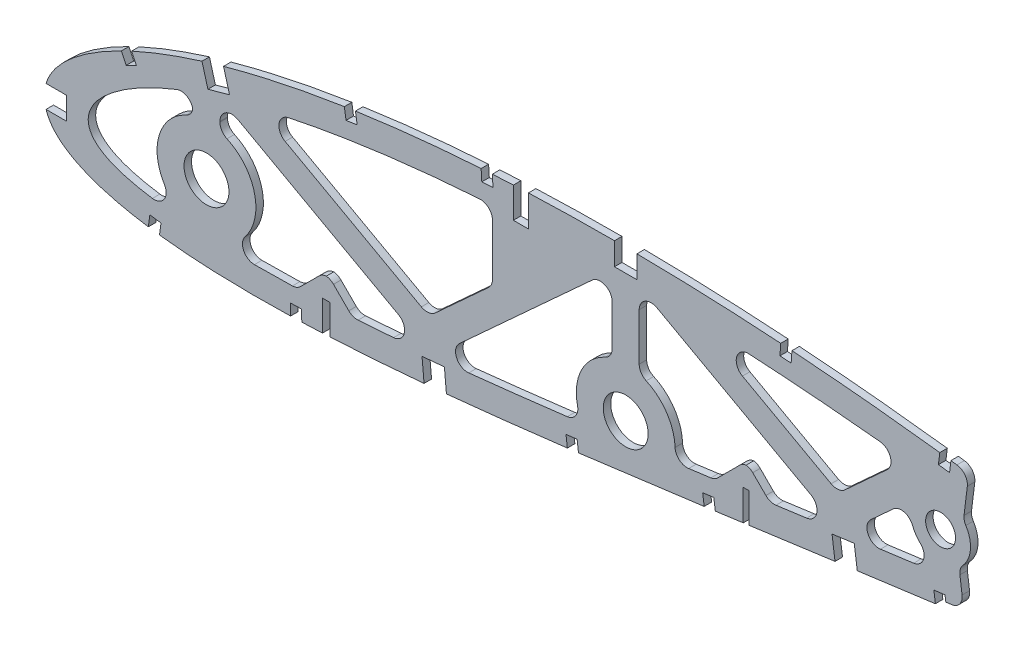
from build123d import *

# Parameters (mm, degrees)
BOSS_EXTRUDE1_DEPTH      = 3.175
CUT_EXTRUDE2_START       = -3.175
CUT_EXTRUDE2_OUTLINE_R   = 9.525
CUT_EXTRUDE2_OUTLINE_R_2 = 6.35
CUT_EXTRUDE2_DEPTH       = 3.175
CUT_EXTRUDE3_DEPTH       = 399.850153183
SKETCH3_W                = 3.175
SKETCH3_H                = 5.08
SKETCH3_W_2              = 2.54
BOSS_EXTRUDE2_DEPTH      = 3.175
CUT_EXTRUDE4_DEPTH       = 3.175
FILLET1_START            = -1
FILLET1_DEPTH            = 5
FILLET1_2_DEPTH          = 3.175


with BuildPart() as part:
    # Sketch1 → Boss-Extrude1 (new body)
    with BuildSketch(Plane.XY):
        with BuildLine():
            Line((554.319679776, 0.86419944), (558.957809165, -2.001035064))
            Line((558.957809165, -2.001035064), (553.628320224, -0.86419944))
            add(Edge.make_bspline(
                [(0, 0), (0.142347333, -0.671974339), (0.427696201, -2.019011291), (1.202951825, -3.958186399), (2.228190383, -5.822295383), (3.524929277, -7.606386734), (5.084546434, -9.309972854), (6.903597265, -10.934825666), (8.980297835, -12.480071531), (11.311930113, -13.945007192), (13.895107055, -15.331187734), (16.726925172, -16.637751335), (19.804802415, -17.864289685), (23.125385358, -19.009163213), (26.684614497, -20.074115536), (30.479105895, -21.056551439), (34.504544841, -21.957844058), (38.757059621, -22.775692741), (43.232016315, -23.51092839), (47.924766072, -24.163139529), (52.830492114, -24.732734078), (57.944381557, -25.218516849), (63.261376247, -25.621532707), (68.776176668, -25.942049027), (74.483429701, -26.181082136), (80.377668399, -26.337723359), (86.453120028, -26.414414727), (92.704294081, -26.412307583), (99.12507542, -26.330838336), (105.709979181, -26.174507632), (112.452686417, -25.942325241), (119.34710982, -25.637100851), (126.387030529, -25.261906112), (133.566134503, -24.818012975), (140.878103886, -24.307388732), (148.316589874, -23.734128332), (155.874835295, -23.099661672), (163.546248351, -22.407686904), (171.324037493, -21.661668186), (179.201482843, -20.863966544), (187.171631155, -20.018334408), (195.227383554, -19.127512044), (203.361887075, -18.196251983), (211.567710876, -17.226239107), (219.837916048, -16.22301178), (228.164722411, -15.188486752), (236.541167073, -14.126648704), (244.959716224, -13.042497308), (253.412488668, -11.935908902), (261.892375024, -10.814767477), (270.391197565, -9.678149682), (278.901558654, -8.531901132), (287.415580323, -7.379584718), (295.924969849, -6.221555103), (304.422247183, -5.062611436), (312.899529628, -3.905935256), (321.348513524, -2.751632242), (329.761554776, -1.605439772), (338.130181703, -0.467217682), (346.446677596, 0.66072628), (354.703072912, 1.775025333), (362.891578136, 2.874273125), (371.003746299, 3.95777416), (379.031415912, 5.025935363), (386.846329345, 6.046335331), (394.428066205, 7.073310729), (401.802175451, 7.915202937), (409.084467689, 8.633788237), (416.282507375, 9.222929029), (423.387651297, 9.691101248), (430.391758492, 10.041650224), (437.286481508, 10.279470026), (444.063111322, 10.411615906), (450.713183761, 10.441441391), (457.227621753, 10.378458054), (463.597952606, 10.227742854), (469.815285453, 9.996060674), (475.870946567, 9.691228076), (481.756334452, 9.321555013), (487.462613384, 8.892494437), (492.981831848, 8.414063018), (498.305474549, 7.893264408), (503.42536692, 7.336048865), (508.334038343, 6.754092224), (513.023631908, 6.151226115), (517.487093749, 5.537357776), (521.717238913, 4.918708145), (525.707368004, 4.303175514), (529.451211936, 3.69663199), (532.942723228, 3.107128036), (536.176432542, 2.540171416), (539.146728498, 2.001298937), (541.849490456, 1.497309641), (544.279380439, 1.030707122), (546.433148645, 0.609181062), (548.306790372, 0.234591467), (549.897558991, -0.087784135), (551.202676422, -0.356673457), (552.220160436, -0.56766247), (552.948001318, -0.721088328), (553.38541182, -0.812384542), (553.579758931, -0.853840809), (553.628320224, -0.86419944)],
                knots=[0, 0, 0, 0, 0.003638255, 0.007293231, 0.011028136, 0.014901081, 0.018963272, 0.023258475, 0.027820626, 0.032679082, 0.03785316, 0.043361875, 0.049214679, 0.055422346, 0.061988786, 0.068918036, 0.076211157, 0.083868392, 0.091887411, 0.100265912, 0.108999867, 0.118084529, 0.127514843, 0.13728527, 0.147387917, 0.157816481, 0.168563473, 0.179619128, 0.190977373, 0.202626974, 0.214560478, 0.226767249, 0.239236417, 0.251959004, 0.264923894, 0.278119703, 0.291536035, 0.30516028, 0.318980685, 0.332985499, 0.34716279, 0.361498603, 0.375980747, 0.390597192, 0.405332593, 0.420174823, 0.435109533, 0.450124276, 0.465203068, 0.480333154, 0.495500583, 0.510689775, 0.525887334, 0.541078314, 0.556247233, 0.571381784, 0.58646604, 0.601484516, 0.616424329, 0.631269422, 0.646006524, 0.660620684, 0.675098187, 0.689422858, 0.703581825, 0.716907563, 0.730009274, 0.742952128, 0.755725558, 0.768319952, 0.780724337, 0.792926529, 0.804916041, 0.816679084, 0.828203524, 0.8394749, 0.850481359, 0.861207697, 0.871639326, 0.881763414, 0.891563605, 0.901027364, 0.910138977, 0.918883976, 0.927249278, 0.935221104, 0.942784739, 0.949928188, 0.956638464, 0.962904203, 0.968712288, 0.974054485, 0.978918432, 0.983297218, 0.987180246, 0.990560674, 0.993433357, 0.995790626, 0.997629587, 0.998945816, 0.999736592, 1, 1, 1, 1], degree=3))
            add(Edge.make_bspline(
                [(554.319679776, 0.86419944), (554.277215357, 0.89043211), (554.107522459, 0.995260998), (553.725173452, 1.229788681), (553.088482836, 1.620406322), (552.19717161, 2.164400829), (551.051931791, 2.860327436), (549.65218736, 3.7033132), (547.998812126, 4.690619378), (546.092206237, 5.81757636), (543.932565, 7.078907467), (541.52071076, 8.469502775), (538.856853433, 9.981489509), (535.942024994, 11.608689713), (532.777225355, 13.343364367), (529.363053286, 15.177678879), (525.700731311, 17.102302694), (521.79166531, 19.108957931), (517.636567952, 21.18656326), (513.237398289, 23.326472309), (508.595621965, 25.518015349), (503.712823317, 27.749500198), (498.591807417, 30.011830061), (493.233990123, 32.290940283), (487.642424763, 34.57695634), (481.8194918, 36.856868062), (475.768638934, 39.12029206), (469.492200651, 41.35256543), (462.994868721, 43.543932934), (456.279795024, 45.680158729), (449.351781723, 47.749641178), (442.214854104, 49.738962731), (434.874961581, 51.637921), (427.336759134, 53.432686996), (419.606635925, 55.111247293), (411.690736529, 56.663495899), (403.59569977, 58.073935714), (395.343957759, 59.341467114), (387.068279135, 60.395838633), (378.809627081, 61.42993544), (370.563274167, 62.401374837), (362.216133558, 63.331662392), (353.776235693, 64.21556045), (345.251952273, 65.05030505), (336.651912889, 65.832293537), (327.985054567, 66.559232675), (319.259763743, 67.227003304), (310.485240764, 67.834576684), (301.670160415, 68.37661144), (292.823911811, 68.852700647), (283.955475072, 69.25952388), (275.074079257, 69.594278035), (266.18915515, 69.854942273), (257.309925599, 70.039019354), (248.446004557, 70.145351939), (239.606611877, 70.171034575), (230.801357025, 70.115607817), (222.039460543, 69.97716855), (213.3305417, 69.753821594), (204.683833617, 69.445150093), (196.108686361, 69.051287938), (187.614488849, 68.568936811), (179.210455771, 68.001170586), (170.905945703, 67.345604232), (162.710082946, 66.602063396), (154.631456842, 65.773647434), (146.679061666, 64.85810318), (138.86141998, 63.858035618), (131.187082706, 62.775405546), (123.664660665, 61.60962319), (116.302212041, 60.364055914), (109.107683022, 59.039978082), (102.088685401, 57.641271481), (95.252861003, 56.16830103), (88.607445909, 54.6254852), (82.159346438, 53.015511993), (75.915494147, 51.341328746), (69.8822185, 49.606952764), (64.065620452, 47.816318831), (58.472480769, 45.971394518), (53.107026632, 44.079174913), (47.975848961, 42.141003285), (43.082878389, 40.162850581), (38.433849103, 38.1474178), (34.032234114, 36.100849009), (29.88301504, 34.025474172), (25.989149052, 31.927107779), (22.354545271, 29.808967438), (18.982702419, 27.674987384), (15.875037644, 25.530580581), (13.035835571, 23.377093004), (10.466071509, 21.219966433), (8.16737168, 19.062485607), (6.143021854, 16.906136722), (4.392949166, 14.754717117), (2.919447156, 12.609930647), (1.722771461, 10.473806788), (0.805628768, 8.347897258), (0.167109617, 6.233397613), (-0.182411483, 4.133428796), (-0.269409401, 2.046307302), (-0.089668952, 0.681083253), (0, 0)],
                knots=[0, 0, 0, 0, 0.00025409, 0.001015373, 0.002283359, 0.004056577, 0.006330982, 0.009105274, 0.012374489, 0.016134023, 0.02037966, 0.025105976, 0.030306237, 0.035972206, 0.042099522, 0.048678064, 0.055701664, 0.063160184, 0.071045824, 0.079349827, 0.08806291, 0.097175756, 0.106678112, 0.116561573, 0.126814276, 0.137428301, 0.148393618, 0.15969976, 0.171338126, 0.183297699, 0.195569604, 0.208143555, 0.221011593, 0.234161831, 0.24758745, 0.261276822, 0.27522271, 0.289414144, 0.3037712, 0.317689227, 0.331784111, 0.346039677, 0.360443869, 0.37498272, 0.389640454, 0.404403317, 0.419256601, 0.434186749, 0.449177265, 0.464214782, 0.479284009, 0.49436974, 0.509457833, 0.524532346, 0.53957932, 0.554582984, 0.569529546, 0.584403417, 0.599190992, 0.613876838, 0.628447475, 0.642888675, 0.657186054, 0.671325546, 0.685294014, 0.699078147, 0.712665095, 0.726042645, 0.739197713, 0.752117586, 0.764792042, 0.777208152, 0.789355685, 0.80122396, 0.812803686, 0.824082909, 0.835054602, 0.845709571, 0.856037853, 0.866033834, 0.875688843, 0.884997719, 0.893953426, 0.902552897, 0.910789386, 0.918660734, 0.926166253, 0.933302626, 0.94007122, 0.94647478, 0.952517526, 0.958204819, 0.963546652, 0.9685566, 0.973249913, 0.977651041, 0.981787043, 0.985694226, 0.989415109, 0.993001157, 0.996508416, 1, 1, 1, 1], degree=3))
        make_face()
    extrude(amount=BOSS_EXTRUDE1_DEPTH)

    # Cut-Extrude2: read off the stored shape, not the designer's step
    # Cut-Extrude2 outline → Cut-Extrude2 (cut)
    with BuildSketch(Plane.XY.offset(3.175).offset(CUT_EXTRUDE2_START)):
        with BuildLine():
            Line((62.865, 26.51062499), (62.865, 35.371194991))
            add(Edge.make_bspline(
                [(62.865, 35.371194991), (22.76246738, 21.810295737), (-4.605530705, -4.886229322), (45.651130118, -12.296225469)],
                knots=[0, 0, 0, 0, 1, 1, 1, 1], degree=3))
            ThreePointArc((45.651130118, -12.296225469), (50.632113396, -10.068583428), (50.721470273, -4.612889263))
            ThreePointArc((50.721470273, -4.612889263), (49.058316906, 13.966817852), (62.865, 26.51062499))
        make_face()
        with BuildLine():
            ThreePointArc((252.095, 26.51062499), (264.489764964, 16.892695952), (266.733492485, 1.3652865))
            add(Edge.make_bspline(
                [(266.733492485, 1.3652865), (268.366969982, 1.584002003), (281.651386627, 3.366883879), (299.182126849, 5.757369901), (316.351499986, 8.102364536), (321.861023133, 8.853577955), (323.128166996, 9.026279511)],
                knots=[0.491689101, 0.491689101, 0.491689101, 0.491689101, 0.50044456, 0.56288899, 0.58559344, 0.59237477, 0.59237477, 0.59237477, 0.59237477], degree=3))
            ThreePointArc((323.128166996, 9.026279511), (327.436096941, 13.128695222), (324.895868611, 18.507850835))
            Line((324.895868611, 18.507850835), (252.095, 58.667223644))
            Line((252.095, 58.667223644), (252.095, 26.51062499))
        make_face()
        with BuildLine():
            ThreePointArc((350.32545902, 22.054682282), (349.150260326, 16.154547184), (354.429807705, 13.270268136))
            add(Edge.make_bspline(
                [(354.429807705, 13.270268136), (355.159641297, 13.368426329), (356.72292081, 13.578525236), (361.050011801, 14.159181472), (365.012389599, 14.68913133), (368.140539618, 15.106459985), (368.505422489, 15.155126578)],
                knots=[0.648196103, 0.648196103, 0.648196103, 0.648196103, 0.65209888, 0.656555635, 0.671334545, 0.673285933, 0.673285933, 0.673285933, 0.673285933], degree=3))
            ThreePointArc((368.505422489, 15.155126578), (372.675755085, 18.653635102), (371.286516438, 23.916832974))
            ThreePointArc((371.286516438, 23.916832974), (367.458763624, 30.772693993), (368.393761968, 38.568866132))
            Line((368.393761968, 38.568866132), (350.32545902, 22.054682282))
        make_face()
        with BuildLine():
            Line((336.675400902, 25.063606537), (365.552356002, 51.456751865))
            add(Edge.make_bspline(
                [(365.552356002, 51.456751865), (364.797081097, 51.541135498), (363.28612212, 51.70855557), (356.227836524, 52.477138846), (343.881379823, 53.730686124), (326.217500472, 55.269607058), (305.213684073, 56.778569262), (288.740470923, 57.638941116), (278.330264723, 58.031170169), (276.814196646, 58.08503148)],
                knots=[0.338225804, 0.338225804, 0.338225804, 0.338225804, 0.34212872, 0.346031635, 0.374679876, 0.405903199, 0.437126522, 0.482920481, 0.490726312, 0.490726312, 0.490726312, 0.490726312], degree=3))
            Line((276.814196646, 58.08503148), (336.675400902, 25.063606537))
        make_face()
        with BuildLine():
            Line((189.86500008, 27.78308848), (189.86500008, 57.240060847))
            add(Edge.make_bspline(
                [(189.86500008, 57.240060847), (187.063917312, 57.071520312), (178.038965708, 56.478843678), (157.007825959, 54.710152185), (132.906042701, 51.69376088), (110.107646573, 47.675012244), (97.887220649, 45.070252562), (91.565344534, 43.564313492), (90.226243863, 43.237828083)],
                knots=[0.640183475, 0.640183475, 0.640183475, 0.640183475, 0.654678253, 0.686913106, 0.749359752, 0.780583075, 0.807390144, 0.814611821, 0.814611821, 0.814611821, 0.814611821], degree=3))
            Line((90.226243863, 43.237828083), (162.90759448, 3.144385361))
            Line((162.90759448, 3.144385361), (189.86500008, 27.78308848))
        make_face()
        with BuildLine():
            ThreePointArc((84.95217689, -6.729137926), (84.342190601, -12.099649242), (88.915920299, -14.979835297))
            add(Edge.make_bspline(
                [(88.915920299, -14.979835297), (90.35299962, -14.981325891), (93.229497815, -14.971352785), (101.799896076, -14.869084655), (114.731393163, -14.466783507), (130.155154447, -13.613720807), (141.25346805, -12.820350397), (146.550437705, -12.401296511), (147.935568697, -12.28908831)],
                knots=[0.173000219, 0.173000219, 0.173000219, 0.173000219, 0.180805773, 0.188611327, 0.219444625, 0.25066684, 0.271707071, 0.279155772, 0.279155772, 0.279155772, 0.279155772], degree=3))
            ThreePointArc((147.935568697, -12.28908831), (152.492048606, -8.292757779), (149.979108862, -2.777569594))
            Line((149.979108862, -2.777569594), (74.295, 38.972294131))
            Line((74.295, 38.972294131), (74.295, 26.51062499))
            ThreePointArc((74.295, 26.51062499), (88.534480836, 12.747712058), (84.95217689, -6.729137926))
        make_face()
        with BuildLine():
            ThreePointArc((175.863374995, -0.499099206), (174.657175701, -6.331597494), (179.819975236, -9.301185677))
            add(Edge.make_bspline(
                [(179.819975236, -9.301185677), (181.091416031, -9.16796419), (188.409144309, -8.392799339), (204.460290686, -6.591474723), (219.247423117, -4.787683401), (227.985591734, -3.687816971)],
                knots=[0.336261412, 0.336261412, 0.336261412, 0.336261412, 0.343089121, 0.3755557, 0.422429392, 0.422429392, 0.422429392, 0.422429392], degree=3))
            ThreePointArc((227.985591734, -3.687816971), (227.058965712, 14.46231527), (240.665, 26.51062499))
            Line((240.665, 26.51062499), (240.665, 58.728707198))
            Line((240.665, 58.728707198), (175.863374995, -0.499099206))
        make_face()
        with Locations((246.38, 6.35)):
            Circle(CUT_EXTRUDE2_OUTLINE_R)
        with BuildLine():
            ThreePointArc((389.625833749, 41.421162193), (392.552928096, 31.946069054), (387.776134328, 23.255412427))
            Line((387.776134328, 23.255412427), (389.985810257, 6.471158122))
            add(Edge.make_bspline(
                [(389.985810257, 6.471158122), (391.481008099, 6.669843999), (395.425301496, 7.187163751), (401.802175451, 7.915202937), (409.084467689, 8.633788237), (416.282507375, 9.222929029), (423.387651297, 9.691101248), (430.391758492, 10.041650224), (437.286481508, 10.279470026), (444.063111322, 10.411615906), (450.713183761, 10.441441391), (457.227621753, 10.378458054), (463.597952606, 10.227742854), (469.815285453, 9.996060674), (475.870946567, 9.691228076), (481.756334452, 9.321555013), (487.462613384, 8.892494437), (492.981831848, 8.414063018), (498.305474549, 7.893264408), (503.42536692, 7.336048865), (508.334038343, 6.754092224), (513.023631908, 6.151226115), (517.487093749, 5.537357776), (521.717238913, 4.918708145), (525.707368004, 4.303175514), (529.451211936, 3.69663199), (532.942723228, 3.107128036), (536.176432542, 2.540171416), (539.146728498, 2.001298937), (541.849490456, 1.497309641), (544.279380439, 1.030707122), (546.433148645, 0.609181062), (548.306790372, 0.234591467), (549.897558991, -0.087784135), (551.202676422, -0.356673457), (552.220160436, -0.56766247), (552.948001318, -0.721088328), (553.38541182, -0.812384542), (553.579758931, -0.853840809), (553.628320224, -0.86419944)],
                knots=[0.708906055, 0.708906055, 0.708906055, 0.708906055, 0.716907563, 0.730009274, 0.742952128, 0.755725558, 0.768319952, 0.780724337, 0.792926529, 0.804916041, 0.816679084, 0.828203524, 0.8394749, 0.850481359, 0.861207697, 0.871639326, 0.881763414, 0.891563605, 0.901027364, 0.910138977, 0.918883976, 0.927249278, 0.935221104, 0.942784739, 0.949928188, 0.956638464, 0.962904203, 0.968712288, 0.974054485, 0.978918432, 0.983297218, 0.987180246, 0.990560674, 0.993433357, 0.995790626, 0.997629587, 0.998945816, 0.999736592, 1, 1, 1, 1], degree=3))
            Line((553.628320224, -0.86419944), (558.957809165, -2.001035064))
            Line((558.957809165, -2.001035064), (554.319679776, 0.86419944))
            add(Edge.make_bspline(
                [(554.319679776, 0.86419944), (554.277215357, 0.89043211), (554.107522459, 0.995260998), (553.725173452, 1.229788681), (553.088482836, 1.620406322), (552.19717161, 2.164400829), (551.051931791, 2.860327436), (549.65218736, 3.7033132), (547.998812126, 4.690619378), (546.092206237, 5.81757636), (543.932565, 7.078907467), (541.52071076, 8.469502775), (538.856853433, 9.981489509), (535.942024994, 11.608689713), (532.777225355, 13.343364367), (529.363053286, 15.177678879), (525.700731311, 17.102302694), (521.79166531, 19.108957931), (517.636567952, 21.18656326), (513.237398289, 23.326472309), (508.595621965, 25.518015349), (503.712823317, 27.749500198), (498.591807417, 30.011830061), (493.233990123, 32.290940283), (487.642424763, 34.57695634), (481.8194918, 36.856868062), (475.768638934, 39.12029206), (469.492200651, 41.35256543), (462.994868721, 43.543932934), (456.279795024, 45.680158729), (449.351781723, 47.749641178), (442.214854104, 49.738962731), (434.874961581, 51.637921), (427.336759134, 53.432686996), (419.606635925, 55.111247293), (411.690736529, 56.663495899), (403.59569977, 58.073935714), (396.967104189, 59.092139268), (393.036714305, 59.622971652), (391.868484593, 59.776786455)],
                knots=[0, 0, 0, 0, 0.00025409, 0.001015373, 0.002283359, 0.004056577, 0.006330982, 0.009105274, 0.012374489, 0.016134023, 0.02037966, 0.025105976, 0.030306237, 0.035972206, 0.042099522, 0.048678064, 0.055701664, 0.063160184, 0.071045824, 0.079349827, 0.08806291, 0.097175756, 0.106678112, 0.116561573, 0.126814276, 0.137428301, 0.148393618, 0.15969976, 0.171338126, 0.183297699, 0.195569604, 0.208143555, 0.221011593, 0.234161831, 0.24758745, 0.261276822, 0.27522271, 0.289414144, 0.295412407, 0.295412407, 0.295412407, 0.295412407], degree=3))
            Line((391.868484593, 59.776786455), (389.625833749, 41.421162193))
        make_face()
        with Locations((68.58, 6.35)):
            Circle(CUT_EXTRUDE2_OUTLINE_R)
        with Locations((379.918257434, 33.232574886)):
            Circle(CUT_EXTRUDE2_OUTLINE_R_2)
    extrude(amount=CUT_EXTRUDE2_DEPTH, mode=Mode.SUBTRACT)

    # Sketch2<6> → Cut-Extrude3 (cut, through all)
    with BuildSketch(Plane.XY.offset(3.175)):
        with BuildLine():
            Line((46.282123079, -23.928931383), (46.923353507, -19.196153821))
            Line((46.923353507, -19.196153821), (44.563663151, -18.876446158))
            Line((44.563663151, -18.876446158), (43.9243348, -23.595184923))
            add(Edge.make_bspline(
                [(43.9243348, -23.595184923), (44.709577271, -23.711215689), (45.495540051, -23.822359509), (46.282123079, -23.928931383)],
                knots=[0.093239963, 0.093239963, 0.093239963, 0.093239963, 0.097450722, 0.097450722, 0.097450722, 0.097450722], degree=3))
        make_face()
        with BuildLine():
            Line((49.283043862, -19.515861485), (46.923353507, -19.196153821))
            Line((46.923353507, -19.196153821), (46.282123079, -23.928931383))
            add(Edge.make_bspline(
                [(46.282123079, -23.928931383), (46.808009355, -24.000182203), (47.595005258, -24.10369717), (48.382554507, -24.202850809), (48.643628535, -24.235242195)],
                knots=[0.097450722, 0.097450722, 0.097450722, 0.097450722, 0.100265912, 0.101661472, 0.101661472, 0.101661472, 0.101661472], degree=3))
            Line((48.643628535, -24.235242195), (49.283043862, -19.515861485))
        make_face()
        with BuildLine():
            Line((38.850811769, 33.0821962), (36.798260056, 37.379688226))
            add(Edge.make_bspline(
                [(36.798260056, 37.379688226), (35.854068206, 36.944595052), (34.417979427, 36.267729731), (32.991764689, 35.570359965), (32.50076803, 35.327136512)],
                knots=[0.905497301, 0.905497301, 0.905497301, 0.905497301, 0.910789386, 0.913578602, 0.913578602, 0.913578602, 0.913578602], degree=3))
            Line((32.50076803, 35.327136512), (34.553319743, 31.029644486))
            Line((34.553319743, 31.029644486), (38.850811769, 33.0821962))
        make_face()
        with BuildLine():
            Line((69.187204427, 39.564220025), (73.775611576, 40.840122093))
            Line((73.775611576, 40.840122093), (78.364018724, 42.116024161))
            Line((78.364018724, 42.116024161), (75.812214588, 51.292838459))
            add(Edge.make_bspline(
                [(75.812214588, 51.292838459), (73.811767609, 50.736572557), (70.759892392, 49.859003491), (67.721063759, 48.937534558), (66.6709837, 48.613069038)],
                knots=[0.835139898, 0.835139898, 0.835139898, 0.835139898, 0.845709571, 0.851304368, 0.851304368, 0.851304368, 0.851304368], degree=3))
            Line((66.6709837, 48.613069038), (69.187204427, 39.564220025))
        make_face()
        with BuildLine():
            Line((104.106698263, -21.443073409), (104.252255503, -26.203348542))
            add(Edge.make_bspline(
                [(104.252255503, -26.203348542), (104.720230733, -26.190827386), (105.513674618, -26.168693156), (106.307074257, -26.145045284), (106.632531393, -26.135093624)],
                knots=[0.20014354, 0.20014354, 0.20014354, 0.20014354, 0.202626974, 0.204354288, 0.204354288, 0.204354288, 0.204354288], degree=3))
            Line((106.632531393, -26.135093624), (106.48683583, -21.370294789))
            Line((106.48683583, -21.370294789), (104.106698263, -21.443073409))
        make_face()
        with BuildLine():
            Line((108.866973396, -21.297516169), (106.48683583, -21.370294789))
            Line((106.48683583, -21.370294789), (106.632531393, -26.135093624))
            add(Edge.make_bspline(
                [(106.632531393, -26.135093624), (107.425912325, -26.110834031), (108.21924761, -26.085083218), (109.012533833, -26.057895847)],
                knots=[0.204354288, 0.204354288, 0.204354288, 0.204354288, 0.208565035, 0.208565035, 0.208565035, 0.208565035], degree=3))
            Line((109.012533833, -26.057895847), (108.866973396, -21.297516169))
        make_face()
        with BuildLine():
            Line((127.771211762, 57.422190036), (130.125676221, 57.778348255))
            Line((130.125676221, 57.778348255), (129.583477257, 62.518101997))
            add(Edge.make_bspline(
                [(129.583477257, 62.518101997), (128.741656434, 62.391032848), (127.900124949, 62.262045789), (127.058895324, 62.131118953)],
                knots=[0.741874989, 0.741874989, 0.741874989, 0.741874989, 0.746208858, 0.746208858, 0.746208858, 0.746208858], degree=3))
            Line((127.058895324, 62.131118953), (127.771211762, 57.422190036))
        make_face()
        with BuildLine():
            Line((129.583477257, 62.518101997), (130.125676221, 57.778348255))
            Line((130.125676221, 57.778348255), (132.480140679, 58.134506475))
            Line((132.480140679, 58.134506475), (131.76782424, 62.843435391))
            add(Edge.make_bspline(
                [(131.76782424, 62.843435391), (131.559841446, 62.812874242), (130.83157431, 62.705448955), (130.103517718, 62.596599816), (129.583477257, 62.518101997)],
                knots=[0.738127599, 0.738127599, 0.738127599, 0.738127599, 0.739197713, 0.741874989, 0.741874989, 0.741874989, 0.741874989], degree=3))
        make_face()
        with BuildLine():
            Line((159.993993488, -13.128883679), (160.860592372, -22.64756926))
            add(Edge.make_bspline(
                [(160.860592372, -22.64756926), (161.743392203, -22.567197517), (164.905050661, -22.276138875), (168.065684683, -21.974087842), (170.34336475, -21.751050719)],
                knots=[0.300457763, 0.300457763, 0.300457763, 0.300457763, 0.30516028, 0.317300898, 0.317300898, 0.317300898, 0.317300898], degree=3))
            Line((170.34336475, -21.751050719), (169.479762639, -12.265281568))
            Line((169.479762639, -12.265281568), (159.993993488, -13.128883679))
        make_face()
        with BuildLine():
            Line((185.349576322, 63.637065961), (187.726203141, 63.785378225))
            Line((187.726203141, 63.785378225), (187.18380527, 68.526870756))
            add(Edge.make_bspline(
                [(187.18380527, 68.526870756), (186.473459079, 68.482323115), (185.763173314, 68.436811372), (185.052951793, 68.390319598)],
                knots=[0.64357456, 0.64357456, 0.64357456, 0.64357456, 0.647197719, 0.647197719, 0.647197719, 0.647197719], degree=3))
            Line((185.052951793, 68.390319598), (185.349576322, 63.637065961))
        make_face()
        with BuildLine():
            Line((187.18380527, 68.526870756), (187.726203141, 63.785378225))
            Line((187.726203141, 63.785378225), (190.102829959, 63.933690489))
            Line((190.102829959, 63.933690489), (189.80620543, 68.686944127))
            add(Edge.make_bspline(
                [(189.80620543, 68.686944127), (189.066484154, 68.643026747), (188.192335869, 68.589892859), (187.318277975, 68.535303886), (187.18380527, 68.526870756)],
                knots=[0.639116453, 0.639116453, 0.639116453, 0.639116453, 0.642888675, 0.64357456, 0.64357456, 0.64357456, 0.64357456], degree=3))
        make_face()
        with BuildLine():
            add(Edge.make_bspline(
                [(251.146356975, 70.108083525), (250.243381525, 70.117300822), (247.068451926, 70.145350405), (243.893405422, 70.157877141), (241.621376732, 70.158797251)],
                knots=[0.534982426, 0.534982426, 0.534982426, 0.534982426, 0.53957932, 0.551145224, 0.551145224, 0.551145224, 0.551145224], degree=3))
            Line((241.621376732, 70.158797251), (241.617500391, 60.586941672))
            Line((241.617500391, 60.586941672), (251.142499609, 60.583084306))
            Line((251.142499609, 60.583084306), (251.146356975, 70.108083525))
        make_face()
        with BuildLine():
            add(Edge.make_bspline(
                [(221.639385319, -15.99720981), (223.214934587, -15.802784678), (224.790328976, -15.607104246), (226.365579887, -15.410276118)],
                knots=[0.40857865, 0.40857865, 0.40857865, 0.40857865, 0.41700016, 0.41700016, 0.41700016, 0.41700016], degree=3))
            Line((226.365579887, -15.410276118), (225.778619352, -10.684084883))
            Line((225.778619352, -10.684084883), (221.052428118, -11.271045418))
            Line((221.052428118, -11.271045418), (221.639385319, -15.99720981))
        make_face()
        with BuildLine():
            Line((279.020424763, -3.709183107), (279.658796345, -8.428710557))
            add(Edge.make_bspline(
                [(279.658796345, -8.428710557), (281.232009477, -8.216209427), (282.805184279, -8.00342448), (284.378317727, -7.790334352)],
                knots=[0.512043959, 0.512043959, 0.512043959, 0.512043959, 0.520465471, 0.520465471, 0.520465471, 0.520465471], degree=3))
            Line((284.378317727, -7.790334352), (283.739946867, -3.070812247))
            Line((283.739946867, -3.070812247), (279.020424763, -3.709183107))
        make_face()
        with BuildLine():
            add(Edge.make_bspline(
                [(316.87713003, 67.387648814), (315.293601959, 67.499895799), (313.709849617, 67.60897624), (312.12587904, 67.714788367)],
                knots=[0.423334329, 0.423334329, 0.423334329, 0.423334329, 0.431415612, 0.431415612, 0.431415612, 0.431415612], degree=3))
            Line((312.12587904, 67.714788367), (311.798716004, 62.963564334))
            Line((311.798716004, 62.963564334), (316.549965257, 62.636399561))
            Line((316.549965257, 62.636399561), (316.87713003, 67.387648814))
        make_face()
        with BuildLine():
            Line((379.005557107, 56.598220421), (381.369230672, 56.309431849))
            Line((381.369230672, 56.309431849), (383.732904238, 56.020643278))
            Line((383.732904238, 56.020643278), (384.309509265, 60.740033841))
            add(Edge.make_bspline(
                [(384.309509265, 60.740033841), (382.734312975, 60.937410239), (381.15891565, 61.133041957), (379.583134251, 61.325567552)],
                knots=[0.308342472, 0.308342472, 0.308342472, 0.308342472, 0.316423812, 0.316423812, 0.316423812, 0.316423812], degree=3))
            Line((379.583134251, 61.325567552), (379.198003826, 58.173356236))
            Line((379.198003826, 58.173356236), (379.005557107, 56.598220421))
        make_face()
        with BuildLine():
            Line((343.309836383, 9.849199641), (338.590744176, 9.207658529))
            Line((338.590744176, 9.207658529), (333.87165197, 8.566117418))
            Line((333.87165197, 8.566117418), (335.154734193, -0.872066995))
            add(Edge.make_bspline(
                [(335.154734193, -0.872066995), (336.152463021, -0.736429878), (339.298549265, -0.308917377), (342.444726547, 0.117925554), (344.593205063, 0.408908086)],
                knots=[0.611082802, 0.611082802, 0.611082802, 0.611082802, 0.616424329, 0.627925826, 0.627925826, 0.627925826, 0.627925826], degree=3))
            Line((344.593205063, 0.408908086), (343.309836383, 9.849199641))
        make_face()
        with BuildLine():
            Line((377.088501986, 9.569951123), (377.710129362, 4.848194495))
            add(Edge.make_bspline(
                [(377.710129362, 4.848194495), (378.161009674, 4.907801442), (379.734854981, 5.115578614), (381.308846864, 5.322216845), (382.43188599, 5.469821871)],
                knots=[0.687010174, 0.687010174, 0.687010174, 0.687010174, 0.689422858, 0.695431707, 0.695431707, 0.695431707, 0.695431707], degree=3))
            Line((382.43188599, 5.469821871), (382.141793214, 7.673308298))
            Line((382.141793214, 7.673308298), (381.810258614, 10.191578499))
            Line((381.810258614, 10.191578499), (377.088501986, 9.569951123))
        make_face()
        with BuildLine():
            Line((-0.22218795, -2.160078804), (0.533432975, -2.160078804))
            add(Edge.make_bspline(
                [(0, 0), (0.142347333, -0.671974339), (0.296309585, -1.398778843), (0.516458745, -2.106775827), (0.533432975, -2.160078804)],
                knots=[0, 0, 0, 0, 0.003638255, 0.003935121, 0.003935121, 0.003935121, 0.003935121], degree=3))
            add(Edge.make_bspline(
                [(-0.22218795, 2.602421331), (-0.222187952, 2.417105545), (-0.20355693, 1.546122861), (-0.089668952, 0.681083253), (0, 0)],
                knots=[0.995565361, 0.995565361, 0.995565361, 0.995565361, 0.996508416, 1, 1, 1, 1], degree=3))
            Line((-0.22218795, 2.602421331), (-0.22218795, -2.160078804))
        make_face()
        with BuildLine():
            add(Edge.make_bspline(
                [(0, 0), (0.142347333, -0.671974339), (0.296309585, -1.398778843), (0.516458745, -2.106775827), (0.533432975, -2.160078804)],
                knots=[0, 0, 0, 0, 0.003638255, 0.003935121, 0.003935121, 0.003935121, 0.003935121], degree=3))
            Line((0.533432975, -2.160078804), (9.30281205, -2.160078804))
            Line((9.30281205, -2.160078804), (9.30281205, 7.364921196))
            Line((9.30281205, 7.364921196), (0.520416055, 7.364921196))
            add(Edge.make_bspline(
                [(0.520416055, 7.364921196), (0.402409692, 6.979356896), (0.113144032, 5.909165268), (-0.151931375, 4.316557304), (-0.222187945, 3.106302119), (-0.22218795, 2.602421331)],
                knots=[0.987363922, 0.987363922, 0.987363922, 0.987363922, 0.989415109, 0.993001157, 0.995565361, 0.995565361, 0.995565361, 0.995565361], degree=3))
            add(Edge.make_bspline(
                [(-0.22218795, 2.602421331), (-0.222187952, 2.417105545), (-0.20355693, 1.546122861), (-0.089668952, 0.681083253), (0, 0)],
                knots=[0.995565361, 0.995565361, 0.995565361, 0.995565361, 0.996508416, 1, 1, 1, 1], degree=3))
        make_face()
        with BuildLine():
            add(Edge.make_bspline(
                [(0.520416055, 7.364921196), (0.402409692, 6.979356896), (0.113144032, 5.909165268), (-0.151931375, 4.316557304), (-0.222187945, 3.106302119), (-0.22218795, 2.602421331)],
                knots=[0.987363922, 0.987363922, 0.987363922, 0.987363922, 0.989415109, 0.993001157, 0.995565361, 0.995565361, 0.995565361, 0.995565361], degree=3))
            Line((0.520416055, 7.364921196), (-0.22218795, 7.364921196))
            Line((-0.22218795, 7.364921196), (-0.22218795, 2.602421331))
        make_face()
        with BuildLine():
            Line((389.985810257, 6.471158122), (389.69660382, 8.667912099))
            Line((389.69660382, 8.667912099), (382.141793214, 7.673308298))
            Line((382.141793214, 7.673308298), (382.43188599, 5.469821871))
            add(Edge.make_bspline(
                [(382.43188599, 5.469821871), (383.955123063, 5.670026338), (386.473384877, 6.001525032), (388.990900643, 6.338951879), (389.985810257, 6.471158122)],
                knots=[0.695431707, 0.695431707, 0.695431707, 0.695431707, 0.703581825, 0.708906055, 0.708906055, 0.708906055, 0.708906055], degree=3))
        make_face()
        with BuildLine():
            add(Edge.make_bspline(
                [(205.105000081, 58.008588854), (202.98765536, 57.921981523), (200.87100063, 57.82717704), (198.755000081, 57.723969992)],
                knots=[0.613919647, 0.613919647, 0.613919647, 0.613919647, 0.624857754, 0.624857754, 0.624857754, 0.624857754], degree=3))
            Line((205.105000081, 58.008588854), (205.105000081, 69.447541541))
            add(Edge.make_bspline(
                [(205.105000081, 69.447541541), (204.957270651, 69.441586958), (202.840280196, 69.355700111), (200.72361373, 69.261840736), (198.755000081, 69.16730818)],
                knots=[0.613124202, 0.613124202, 0.613124202, 0.613124202, 0.613876838, 0.623909727, 0.623909727, 0.623909727, 0.623909727], degree=3))
            Line((198.755000081, 69.16730818), (198.755000081, 57.723969992))
        make_face()
        with BuildLine():
            Line((205.10500008, 56.21330818), (205.105000081, 58.008588854))
            add(Edge.make_bspline(
                [(205.105000081, 58.008588854), (202.98765536, 57.921981523), (200.87100063, 57.82717704), (198.755000081, 57.723969992)],
                knots=[0.613919647, 0.613919647, 0.613919647, 0.613919647, 0.624857754, 0.624857754, 0.624857754, 0.624857754], degree=3))
            Line((198.755000081, 57.723969992), (198.75500008, 56.21330818))
            Line((198.75500008, 56.21330818), (205.10500008, 56.21330818))
        make_face()
    extrude(amount=-CUT_EXTRUDE3_DEPTH, mode=Mode.SUBTRACT)

    # Sketch3 → Boss-Extrude2 (add)
    with BuildSketch(Plane.XY.offset(3.175)):
        with BuildLine():
            Line((117.7925, -12.845856054), (117.7925, -7.765856054))
            Line((117.7925, -7.765856054), (113.9825, -7.765856054))
            Line((113.9825, -7.765856054), (107.062440265, -14.685915789))
            add(Edge.make_bspline(
                [(107.062440265, -14.685915789), (109.595464269, -14.60527965), (113.171446106, -14.470070669), (116.750498224, -14.307794097), (117.7925, -14.258351018)],
                knots=[0.205759379, 0.205759379, 0.205759379, 0.205759379, 0.219444625, 0.225063514, 0.225063514, 0.225063514, 0.225063514], degree=3))
            Line((117.7925, -14.258351018), (117.7925, -12.845856054))
        make_face()
        with Locations((119.38, -10.305856054)):
            Rectangle(SKETCH3_W, SKETCH3_H)
        Polygon((120.9675, -3.955856054), (124.7775, -7.765856054), (120.9675, -7.765856054), (117.7925, -7.765856054), (113.9825, -7.765856054), (117.7925, -3.955856054), align=None)
        with BuildLine():
            Line((124.7775, -7.765856054), (120.9675, -7.765856054))
            Line((120.9675, -7.765856054), (120.9675, -12.845856054))
            Line((120.9675, -12.845856054), (120.9675, -14.100986521))
            add(Edge.make_bspline(
                [(120.9675, -14.100986521), (124.163125268, -13.935936547), (127.360827902, -13.750933621), (130.560049739, -13.548405793)],
                knots=[0.230769167, 0.230769167, 0.230769167, 0.230769167, 0.2479935, 0.2479935, 0.2479935, 0.2479935], degree=3))
            Line((130.560049739, -13.548405793), (124.7775, -7.765856054))
        make_face()
        with BuildLine():
            Line((296.2275, 5.35570775), (296.2275, 6.866266587))
            Line((296.2275, 6.866266587), (296.2275, 11.946266587))
            Line((296.2275, 11.946266587), (292.4175, 11.946266587))
            Line((292.4175, 11.946266587), (284.190178888, 3.718945475))
            add(Edge.make_bspline(
                [(284.190178888, 3.718945475), (288.202049696, 4.262979281), (292.214521898, 4.808844205), (296.2275, 5.35570775)],
                knots=[0.522870866, 0.522870866, 0.522870866, 0.522870866, 0.544364295, 0.544364295, 0.544364295, 0.544364295], degree=3))
        make_face()
        Polygon((298.7675, 15.756266587), (302.5775, 11.946266587), (298.7675, 11.946266587), (296.2275, 11.946266587), (292.4175, 11.946266587), (296.2275, 15.756266587), align=None)
        with BuildLine():
            Line((298.7675, 11.946266587), (298.7675, 6.866266587))
            Line((298.7675, 6.866266587), (298.7675, 5.701959504))
            add(Edge.make_bspline(
                [(298.7675, 5.701959504), (301.379685874, 6.058163443), (304.328670822, 6.460656034), (307.27788446, 6.86330039), (307.614507351, 6.909259236)],
                knots=[0.548898905, 0.548898905, 0.548898905, 0.548898905, 0.56288899, 0.564691541, 0.564691541, 0.564691541, 0.564691541], degree=3))
            Line((307.614507351, 6.909259236), (302.5775, 11.946266587))
            Line((302.5775, 11.946266587), (298.7675, 11.946266587))
        make_face()
        with Locations((297.4975, 9.406266587)):
            Rectangle(SKETCH3_W_2, SKETCH3_H)
    extrude(amount=-BOSS_EXTRUDE2_DEPTH)

    # Sketch3<3> → Cut-Extrude4 (cut)
    with BuildSketch(Plane.XY.offset(3.175)):
        with BuildLine():
            Line((298.7675, -12.845856054), (298.7675, 5.701959504))
            add(Edge.make_bspline(
                [(296.2275, 5.35570775), (297.074144447, 5.471083157), (297.920811413, 5.586503015), (298.7675, 5.701959504)],
                knots=[0.544364295, 0.544364295, 0.544364295, 0.544364295, 0.548898905, 0.548898905, 0.548898905, 0.548898905], degree=3))
            Line((296.2275, 5.35570775), (296.2275, -12.845856054))
            Line((296.2275, -12.845856054), (298.7675, -12.845856054))
        make_face()
        with BuildLine():
            add(Edge.make_bspline(
                [(117.7925, -14.258351018), (118.850591858, -14.208144463), (119.908931954, -14.155660212), (120.9675, -14.100986521)],
                knots=[0.225063514, 0.225063514, 0.225063514, 0.225063514, 0.230769167, 0.230769167, 0.230769167, 0.230769167], degree=3))
            Line((117.7925, -14.258351018), (117.7925, -28.212035313))
            Line((117.7925, -28.212035313), (120.9675, -28.212035313))
            Line((120.9675, -28.212035313), (120.9675, -14.100986521))
        make_face()
    extrude(amount=-CUT_EXTRUDE4_DEPTH, mode=Mode.SUBTRACT)

    # Fillet1: read off the stored shape, not the designer's step
    # Fillet1 outline → Fillet1 (cut)
    with BuildSketch(Plane.XY.offset(FILLET1_START)):
        with BuildLine():
            ThreePointArc((297.4975, 15.687304622), (298.987384974, 15.193456673), (300.255397552, 14.268369035))
            Line((300.255397552, 14.268369035), (298.7675, 15.756266587))
            Line((298.7675, 15.756266587), (296.2275, 15.756266587))
            Line((296.2275, 15.756266587), (294.739602448, 14.268369035))
            ThreePointArc((294.739602448, 14.268369035), (296.007615026, 15.193456673), (297.4975, 15.687304622))
        make_face()
        with BuildLine():
            ThreePointArc((119.38, -3.982202321), (121.043801349, -4.447632813), (122.455397552, -5.443753605))
            Line((122.455397552, -5.443753605), (120.9675, -3.955856054))
            Line((120.9675, -3.955856054), (117.7925, -3.955856054))
            Line((117.7925, -3.955856054), (116.304602448, -5.443753605))
            ThreePointArc((116.304602448, -5.443753605), (117.716198651, -4.447632813), (119.38, -3.982202321))
        make_face()
        with BuildLine():
            Line((389.69660382, 8.667912099), (389.033534618, 13.704452503))
            ThreePointArc((389.033534618, 13.704452503), (388.027226816, 9.948872157), (384.660063416, 8.004842898))
            Line((384.660063416, 8.004842898), (389.69660382, 8.667912099))
        make_face()
        with BuildLine():
            ThreePointArc((386.849902678, 60.420396092), (390.221072292, 58.50231762), (391.256072881, 54.76432573))
            Line((391.256072881, 54.76432573), (391.868484588, 59.776786456))
            add(Edge.make_bspline(
                [(391.868484588, 59.776786456), (390.240515174, 59.991132824), (388.56734946, 60.20352598), (386.894073704, 60.414819194), (386.849902678, 60.420396092)],
                knots=[0.295412407, 0.295412407, 0.295412407, 0.295412407, 0.3037712, 0.303997837, 0.303997837, 0.303997837, 0.303997837], degree=3))
        make_face()
    extrude(amount=FILLET1_DEPTH, mode=Mode.SUBTRACT)

    # Fillet1 2 outline → Fillet1 2 (add)
    with BuildSketch(Plane.XY):
        with BuildLine():
            Line((252.095, 58.667223644), (252.095, 50.063266659))
            ThreePointArc((252.095, 50.063266659), (254.592221554, 54.437698678), (259.628722636, 54.511372461))
            Line((259.628722636, 54.511372461), (252.095, 58.667223644))
        make_face()
        with BuildLine():
            ThreePointArc((252.095, 26.51062499), (253.602490136, 26.020985263), (255.068658537, 25.418802737))
            ThreePointArc((255.068658537, 25.418802737), (252.902611053, 27.293253748), (252.095, 30.041542795))
            Line((252.095, 30.041542795), (252.095, 26.51062499))
        make_face()
        with BuildLine():
            add(Edge.make_bspline(
                [(266.733492485, 1.3652865), (268.366969982, 1.584002003), (270.481481639, 1.86778748), (272.596188199, 2.152323551), (273.077167792, 2.217075937)],
                knots=[0.491689101, 0.491689101, 0.491689101, 0.491689101, 0.50044456, 0.503022154, 0.503022154, 0.503022154, 0.503022154], degree=3))
            ThreePointArc((273.077167792, 2.217075937), (269.122221311, 3.370082852), (267.322429415, 7.075723922))
            ThreePointArc((267.322429415, 7.075723922), (267.224437274, 4.200241936), (266.733492485, 1.3652865))
        make_face()
        with BuildLine():
            Line((284.190178888, 3.718945475), (285.401882026, 4.930648613))
            ThreePointArc((285.401882026, 4.930648613), (284.065166028, 3.970868818), (282.491781723, 3.488739433))
            add(Edge.make_bspline(
                [(282.491781723, 3.488739433), (283.057901956, 3.565436756), (283.624034434, 3.642172883), (284.190178888, 3.718945475)],
                knots=[0.519837771, 0.519837771, 0.519837771, 0.519837771, 0.522870866, 0.522870866, 0.522870866, 0.522870866], degree=3))
        make_face()
        with BuildLine():
            ThreePointArc((310.111686521, 7.250208993), (307.803091041, 7.469202535), (305.832358797, 8.69140779))
            Line((305.832358797, 8.69140779), (307.614507351, 6.909259236))
            add(Edge.make_bspline(
                [(307.614507351, 6.909259236), (308.446876217, 7.022901869), (309.279266574, 7.136553959), (310.111686521, 7.250208993)],
                knots=[0.564691541, 0.564691541, 0.564691541, 0.564691541, 0.569148716, 0.569148716, 0.569148716, 0.569148716], degree=3))
        make_face()
        with BuildLine():
            Line((107.062440265, -14.685915789), (108.487137822, -13.261218232))
            ThreePointArc((108.487137822, -13.261218232), (106.90597113, -14.334149265), (105.040283249, -14.747038888))
            add(Edge.make_bspline(
                [(105.040283249, -14.747038888), (105.714180608, -14.727762866), (106.388236388, -14.707378356), (107.062440265, -14.685915789)],
                knots=[0.202116837, 0.202116837, 0.202116837, 0.202116837, 0.205759379, 0.205759379, 0.205759379, 0.205759379], degree=3))
        make_face()
        with BuildLine():
            ThreePointArc((132.860553881, -13.39980087), (130.737988998, -13.08548405), (128.93453366, -11.922889714))
            Line((128.93453366, -11.922889714), (130.560049735, -13.548405793))
            add(Edge.make_bspline(
                [(130.560049735, -13.548405793), (131.056591897, -13.516972022), (131.823398435, -13.467780757), (132.59028726, -13.417604497), (132.860553881, -13.39980087)],
                knots=[0.2479935, 0.2479935, 0.2479935, 0.2479935, 0.25066684, 0.252121616, 0.252121616, 0.252121616, 0.252121616], degree=3))
        make_face()
        with BuildLine():
            ThreePointArc((189.86500008, 30.022211709), (189.433476093, 27.973292295), (188.212216316, 26.272466534))
            Line((188.212216316, 26.272466534), (189.86500008, 27.78308848))
            Line((189.86500008, 27.78308848), (189.86500008, 30.022211709))
        make_face()
        with BuildLine():
            Line((162.90759448, 3.144385361), (165.597570452, 5.602986918))
            ThreePointArc((165.597570452, 5.602986918), (162.769394565, 4.308175556), (159.716631581, 4.904626291))
            Line((159.716631581, 4.904626291), (162.90759448, 3.144385361))
        make_face()
        with BuildLine():
            ThreePointArc((184.443613869, 56.894464598), (188.254305346, 55.53678681), (189.86500008, 51.825948498))
            Line((189.86500008, 51.825948498), (189.86500008, 57.240060847))
            add(Edge.make_bspline(
                [(189.86500008, 57.240060847), (188.057119306, 57.131281058), (186.249941795, 57.0161285), (184.443613869, 56.894464598)],
                knots=[0.640183475, 0.640183475, 0.640183475, 0.640183475, 0.649538725, 0.649538725, 0.649538725, 0.649538725], degree=3))
        make_face()
        with BuildLine():
            Line((90.226243863, 43.237828083), (101.922220802, 36.785939428))
            ThreePointArc((101.922220802, 36.785939428), (99.351920573, 41.986105235), (103.332288544, 46.205683236))
            add(Edge.make_bspline(
                [(103.332288544, 46.205683236), (100.294695326, 45.568026386), (95.917923501, 44.601144743), (91.565344534, 43.564313492), (90.226243863, 43.237828083)],
                knots=[0.791183206, 0.791183206, 0.791183206, 0.791183206, 0.807390144, 0.814611821, 0.814611821, 0.814611821, 0.814611821], degree=3))
        make_face()
        with BuildLine():
            ThreePointArc((388.113468016, 20.693093522), (388.297328282, 22.858792248), (389.369508138, 24.749423341))
            ThreePointArc((389.369508138, 24.749423341), (388.604999729, 23.968099277), (387.776134328, 23.255412427))
            Line((387.776134328, 23.255412427), (388.113468016, 20.693093522))
        make_face()
        with BuildLine():
            ThreePointArc((390.627276235, 40.059500718), (389.956648921, 41.666902367), (389.86838015, 43.406353337))
            Line((389.86838015, 43.406353337), (389.625833749, 41.421162193))
            ThreePointArc((389.625833749, 41.421162193), (390.149233415, 40.757010444), (390.627276235, 40.059500718))
        make_face()
        with BuildLine():
            ThreePointArc((354.328912685, 52.659767526), (358.633389994, 49.199821058), (357.236987995, 43.856618281))
            Line((357.236987995, 43.856618281), (365.552356002, 51.456751865))
            add(Edge.make_bspline(
                [(365.552356002, 51.456751865), (364.797081097, 51.541135498), (363.28612212, 51.70855557), (359.544659823, 52.115966875), (356.559073298, 52.430661041), (354.328912685, 52.659767526)],
                knots=[0.338225804, 0.338225804, 0.338225804, 0.338225804, 0.34212872, 0.346031635, 0.357549411, 0.357549411, 0.357549411, 0.357549411], degree=3))
        make_face()
        with BuildLine():
            Line((336.675400902, 25.063606537), (339.365376875, 27.522208094))
            ThreePointArc((339.365376875, 27.522208094), (336.537200988, 26.227396732), (333.484438004, 26.823847467))
            Line((333.484438004, 26.823847467), (336.675400902, 25.063606537))
        make_face()
        with BuildLine():
            ThreePointArc((295.875379468, 47.570251069), (293.446649454, 53.421231106), (298.610841824, 57.090538131))
            add(Edge.make_bspline(
                [(298.610841824, 57.090538131), (292.86226283, 57.409849085), (285.596451395, 57.757399461), (278.330264723, 58.031170169), (276.814196646, 58.08503148)],
                knots=[0.453314365, 0.453314365, 0.453314365, 0.453314365, 0.482920481, 0.490726312, 0.490726312, 0.490726312, 0.490726312], degree=3))
            Line((276.814196646, 58.08503148), (295.875379468, 47.570251069))
        make_face()
        with BuildLine():
            Line((240.665, 58.728707198), (232.157783765, 50.953226935))
            ThreePointArc((232.157783765, 50.953226935), (237.633919413, 51.851957772), (240.665, 47.20348176))
            Line((240.665, 47.20348176), (240.665, 58.728707198))
        make_face()
        with BuildLine():
            ThreePointArc((227.985591734, -3.687816971), (226.78252069, -1.069624633), (225.94998008, 1.688850886))
            ThreePointArc((225.94998008, 1.688850886), (225.156340954, -2.358031514), (221.621746319, -4.482592877))
            add(Edge.make_bspline(
                [(221.621746319, -4.482592877), (223.742901686, -4.219840451), (225.864186843, -3.95483654), (227.985591734, -3.687816971)],
                knots=[0.411049653, 0.411049653, 0.411049653, 0.411049653, 0.422429392, 0.422429392, 0.422429392, 0.422429392], degree=3))
        make_face()
        with BuildLine():
            Line((240.665, 26.51062499), (240.665, 30.041542795))
            ThreePointArc((240.665, 30.041542795), (239.857388947, 27.293253748), (237.691341463, 25.418802737))
            ThreePointArc((237.691341463, 25.418802737), (239.157509864, 26.020985263), (240.665, 26.51062499))
        make_face()
        with BuildLine():
            Line((74.295, 38.972294131), (74.295, 30.368337146))
            ThreePointArc((74.295, 30.368337146), (76.792221554, 34.742769165), (81.828722636, 34.816442948))
            Line((81.828722636, 34.816442948), (74.295, 38.972294131))
        make_face()
        with BuildLine():
            ThreePointArc((77.268658537, 25.418802737), (75.102611053, 27.293253748), (74.295, 30.041542795))
            Line((74.295, 30.041542795), (74.295, 26.51062499))
            ThreePointArc((74.295, 26.51062499), (75.802490136, 26.020985263), (77.268658537, 25.418802737))
        make_face()
        with BuildLine():
            ThreePointArc((55.936529527, 32.849528681), (60.238020431, 32.566261326), (62.773103133, 29.079655515))
            ThreePointArc((62.773103133, 29.079655515), (61.776647128, 26.899385383), (59.891341463, 25.418802737))
            ThreePointArc((59.891341463, 25.418802737), (61.357509864, 26.020985263), (62.865, 26.51062499))
            Line((62.865, 26.51062499), (62.865, 35.371194991))
            add(Edge.make_bspline(
                [(62.865, 35.371194991), (60.507088669, 34.573853878), (58.193201837, 33.731101656), (55.936529527, 32.849528681)],
                knots=[0, 0, 0, 0, 0.058797068, 0.058797068, 0.058797068, 0.058797068], degree=3))
        make_face()
        with BuildLine():
            ThreePointArc((359.83910662, 30.750027163), (364.454545371, 31.939363608), (368.024018449, 28.780937102))
            ThreePointArc((368.024018449, 28.780937102), (367.227309104, 33.711981294), (368.393761968, 38.568866132))
            Line((368.393761968, 38.568866132), (359.83910662, 30.750027163))
        make_face()
    extrude(amount=FILLET1_2_DEPTH)


solid = part.part
